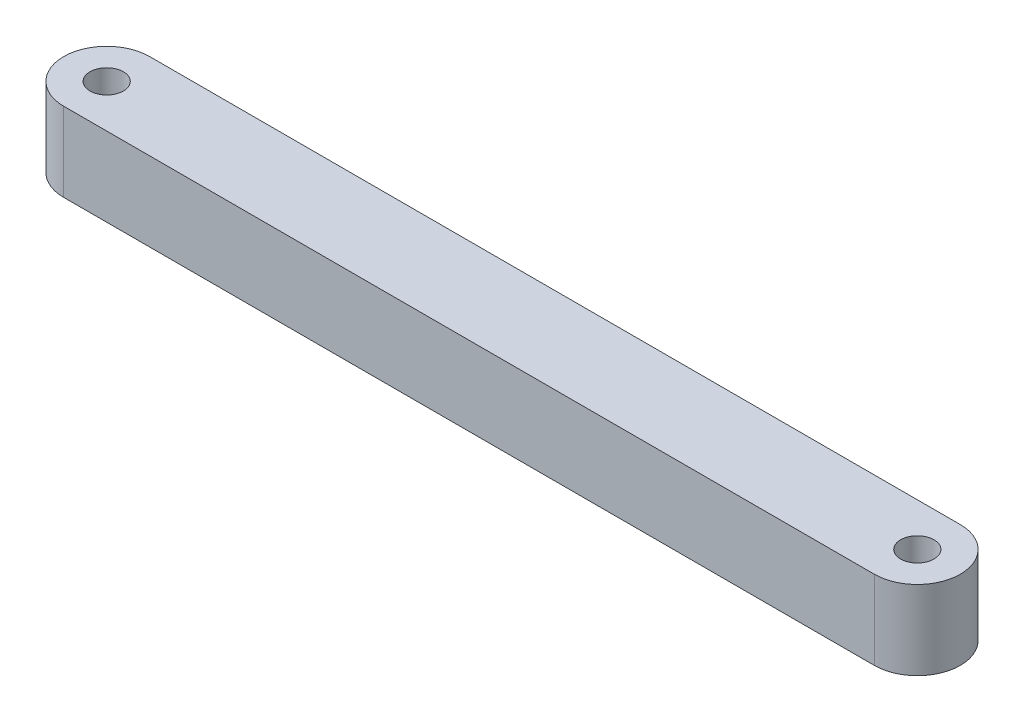
from build123d import *

# Parameters (mm, degrees)
BOSS_EXTRUDE1_DEPTH = 10.2108
SKETCH2_R           = 2.159
CUT_EXTRUDE1_DEPTH  = 111.941953639


with BuildPart() as part:
    # Sketch1 → Boss-Extrude1 (new body)
    with BuildSketch(Plane(origin=(0, 0, 0), x_dir=(1, 0, 0), z_dir=(0, 1, 0))):
        with BuildLine():
            Line((0, 5.55625), (104.775, 5.55625))
            ThreePointArc((104.775, 5.55625), (110.33125, 0), (104.775, -5.55625))
            Line((104.775, -5.55625), (0, -5.55625))
            ThreePointArc((0, -5.55625), (-5.55625, 0), (0, 5.55625))
        make_face()
    extrude(amount=BOSS_EXTRUDE1_DEPTH)

    # Sketch2 → Cut-Extrude1 (cut, through all)
    with BuildSketch(Plane(origin=(0, 10.2108, 0), x_dir=(1, 0, 0), z_dir=(0, 1, 0))):
        with Locations((104.775, 0)):
            Circle(SKETCH2_R)
        Circle(SKETCH2_R)
    extrude(amount=-CUT_EXTRUDE1_DEPTH, mode=Mode.SUBTRACT)


solid = part.part
